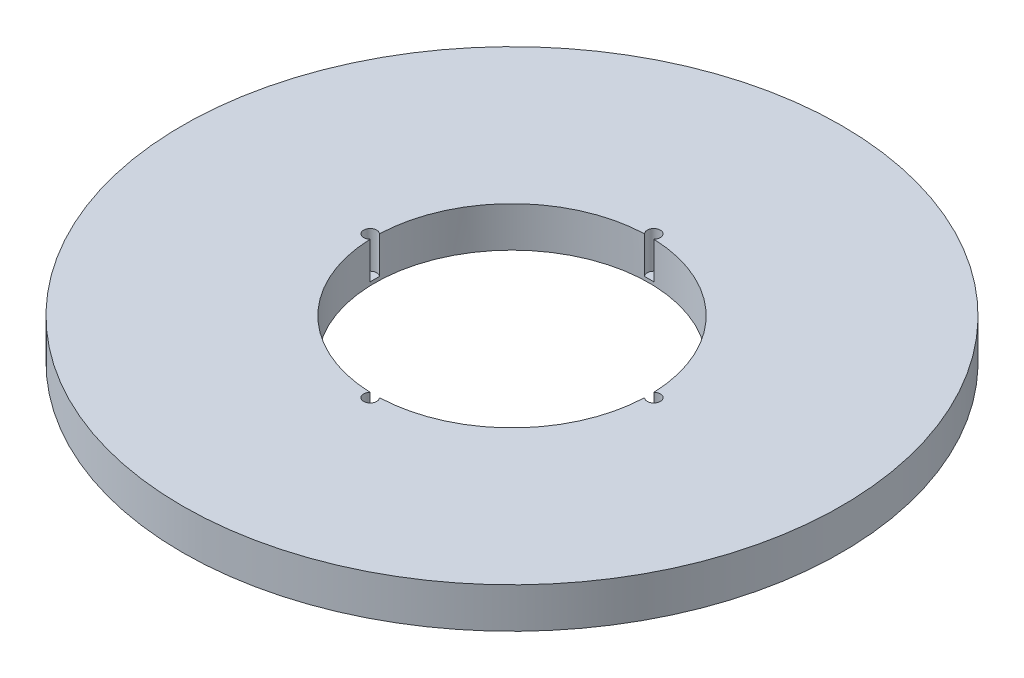
from build123d import *

# Parameters (mm, degrees)
SKETCH1_R           = 90
BOSS_EXTRUDE1_DEPTH = 11
SKETCH2_R           = 37.5
CUT_EXTRUDE1_DEPTH  = 128.753669223
SKETCH3_R           = 1.790846421
CUT_EXTRUDE2_DEPTH  = 10.095690862
CIRPATTERN1_COUNT   = 4


with BuildPart() as part:
    # Sketch1 → Boss-Extrude1 (new body)
    with BuildSketch(Plane(origin=(0, 0, 0), x_dir=(1, 0, 0), z_dir=(0, 1, 0))):
        Circle(SKETCH1_R)
    extrude(amount=BOSS_EXTRUDE1_DEPTH)

    # Sketch2 → Cut-Extrude1 (cut, through all)
    with BuildSketch(Plane(origin=(0, 0, 0), x_dir=(1, 0, 0), z_dir=(0, 1, 0))):
        Circle(SKETCH2_R)
    extrude(amount=CUT_EXTRUDE1_DEPTH, mode=Mode.SUBTRACT)

    # Sketch3 → Cut-Extrude2 (cut)
    with BuildSketch(Plane(origin=(0, 11, 0), x_dir=(1, 0, 0), z_dir=(0, 1, 0))):
        with Locations((-38.72547526, 0)):
            Circle(SKETCH3_R)
    cut_extrude2 = extrude(amount=-CUT_EXTRUDE2_DEPTH, mode=Mode.SUBTRACT)

    # CirPattern1: Cut-Extrude2 ×4 about axis
    cirpattern1_axis = Axis((0, 0, 0), (0, 1, 0))
    for i in range(1, CIRPATTERN1_COUNT):
        add(cut_extrude2.rotate(cirpattern1_axis, i * 360 / CIRPATTERN1_COUNT), mode=Mode.SUBTRACT)


solid = part.part
